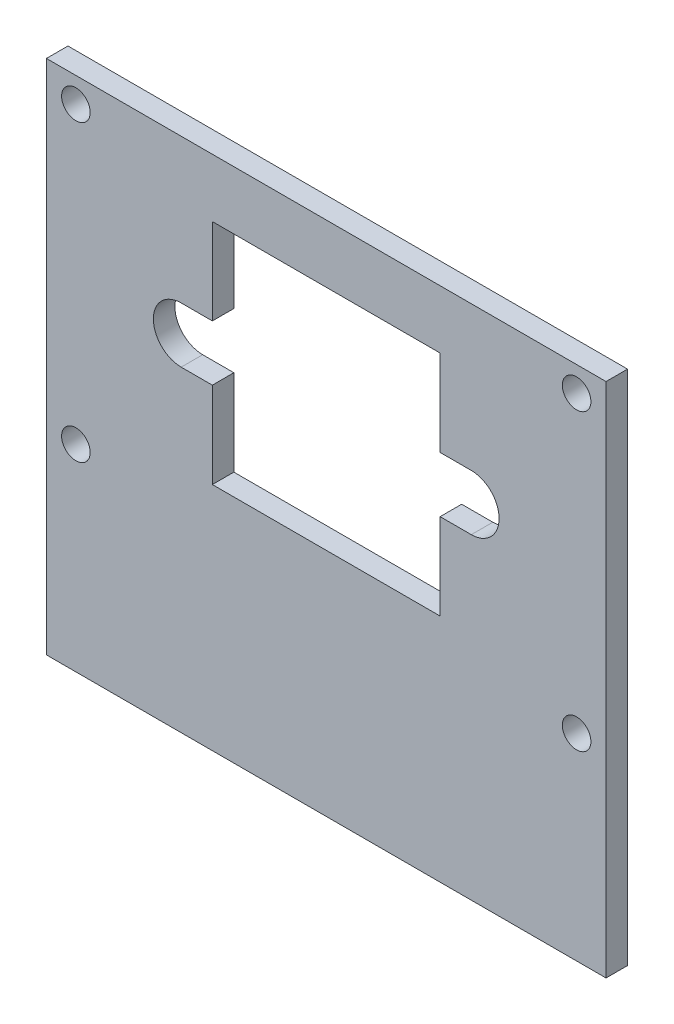
from build123d import *

# Parameters (mm, degrees)
SKETCH1_W           = 41.275
SKETCH1_H           = 38.1
SKETCH1_R           = 1.0541
BOSS_EXTRUDE1_DEPTH = 1.5875


with BuildPart() as part:
    # Sketch1 → Boss-Extrude1 (new body)
    with BuildSketch(Plane.XY):
        with Locations((0, 19.05)):
            Rectangle(SKETCH1_W, SKETCH1_H)
        with Locations((-18.4658, 14.5415)):
            Circle(SKETCH1_R, mode=Mode.SUBTRACT)
        with Locations((18.4658, 14.5415)):
            Circle(SKETCH1_R, mode=Mode.SUBTRACT)
        with BuildLine():
            Line((-8.4, 17), (-8.4, 23.35))
            Line((-8.4, 23.35), (-10.7, 23.35))
            ThreePointArc((-10.7, 23.35), (-12.75, 25.4), (-10.7, 27.45))
            Line((-10.7, 27.45), (-8.4, 27.45))
            Line((-8.4, 27.45), (-8.4, 33.8))
            Line((-8.4, 33.8), (8.4, 33.8))
            Line((8.4, 33.8), (8.4, 27.45))
            Line((8.4, 27.45), (10.7, 27.45))
            ThreePointArc((10.7, 27.45), (12.75, 25.4), (10.7, 23.35))
            Line((10.7, 23.35), (8.4, 23.35))
            Line((8.4, 23.35), (8.4, 17))
            Line((8.4, 17), (-8.4, 17))
        make_face(mode=Mode.SUBTRACT)
        with Locations((-18.4658, 36.2585)):
            Circle(SKETCH1_R, mode=Mode.SUBTRACT)
        with Locations((18.4658, 36.2585)):
            Circle(SKETCH1_R, mode=Mode.SUBTRACT)
    extrude(amount=BOSS_EXTRUDE1_DEPTH)


solid = part.part
